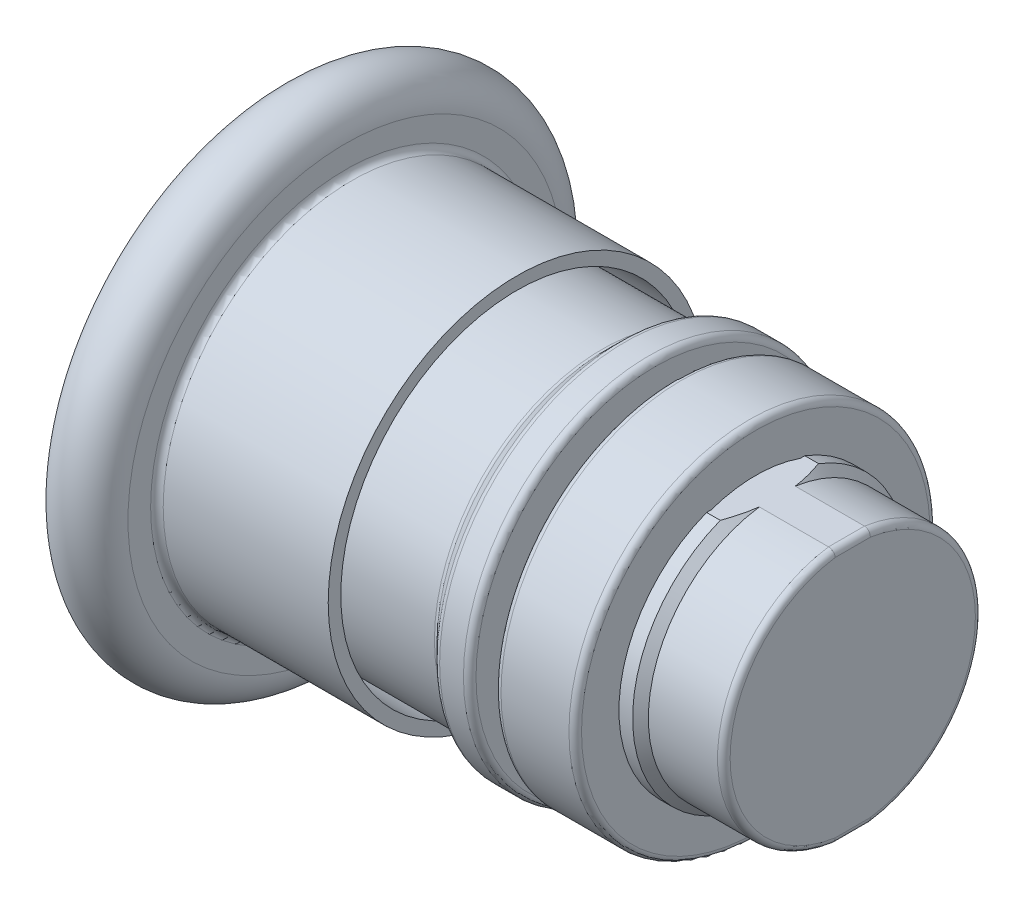
from build123d import *

# Parameters (mm, degrees)
CUT_EXTRUDE1_REACH = 56.598
SKETCH3_W          = 6.4
SKETCH3_H          = 3.6
FILLET1_R          = 0.5
FILLET2_R          = 0.5


with BuildPart() as part:
    # Sketch1 → Revolve-Thin1 (revolve)
    with BuildSketch(Plane.XY, mode=Mode.PRIVATE) as revolve_thin1_sk:
        with BuildLine():
            ThreePointArc((-20, 0), (-19.749798687, 8.817054455), (-19, 17.605731937))
            ThreePointArc((-19, 17.605731937), (-16.164253119, 19.995655135), (-13.617365477, 17.3))
            Line((-13.617365477, 17.3), (-13.617365477, 15))
            Line((-13.617365477, 15), (0, 15))
            Line((0, 15), (0, 14))
            Line((0, 14), (-14.617365477, 14))
            Line((-14.617365477, 14), (-14.617365477, 17.3))
            ThreePointArc((-14.617365477, 17.3), (-16.2209614, 18.997264344), (-18.006431658, 17.492497886))
            ThreePointArc((-18.006431658, 17.492497886), (-18.751407896, 8.760346174), (-19, 0))
            Line((-19, 0), (-20, 0))
        make_face()
    revolve(revolve_thin1_sk.sketch.rotate(Axis((0, 0, 0), (-1, 0, 0)), 90), axis=Axis((0, 0, 0), (-1, 0, 0)))

    # Fillet2
    fillet2_edges = [part.edges().sort_by_distance(p)[0] for p in [
        (-13.617365477, 0, 15),
    ]]
    fillet(fillet2_edges, radius=FILLET2_R)


with BuildPart() as body_2:
    # Sketch2 → Revolve1 (revolve)
    with BuildSketch(Plane.XY, mode=Mode.PRIVATE) as revolve1_sk:
        Polygon((26.7, 0), (26.7, 10.25), (20.7, 10.25), (20.075, 10.875), (11, 10.875), (11, 14.75), (8.4, 14.75), (7, 13.35), (-13.617365477, 13.35), (-13.617365477, 0), align=None)
    revolve(revolve1_sk.sketch.rotate(Axis((0, 0, 0), (1, 0, 0)), 90), axis=Axis((0, 0, 0), (1, 0, 0)))

    # Cut-Extrude1: up to this face of the body (flat: up to its plane)
    cut_extrude1_end = Plane(body_2.part.faces().sort_by_distance((11, 0, -11.292193001))[0])
    # Sketch4 → Cut-Extrude1 (cut, up to the picked face)
    with BuildSketch(Plane(origin=(26.7, 0, 0), x_dir=(0, 0, -1), z_dir=(1, 0, 0)), mode=Mode.PRIVATE) as cut_extrude1_sk1:
        with BuildLine():
            Line((-3.904244485, 10.15), (3.904244485, 10.15))
            ThreePointArc((3.904244485, 10.15), (0, 10.875), (-3.904244485, 10.15))
        make_face()
    cut_extrude1_tool1 = split(extrude(cut_extrude1_sk1.sketch, amount=-CUT_EXTRUDE1_REACH, mode=Mode.PRIVATE), bisect_by=cut_extrude1_end, keep=Keep.BOTH, mode=Mode.PRIVATE)
    # Sketch4 → Cut-Extrude1 (cut, up to the picked face)
    with BuildSketch(Plane(origin=(26.7, 0, 0), x_dir=(0, 0, -1), z_dir=(1, 0, 0)), mode=Mode.PRIVATE) as cut_extrude1_sk2:
        with BuildLine():
            Line((-3.904244485, -10.15), (3.904244485, -10.15))
            ThreePointArc((3.904244485, -10.15), (0, -10.875), (-3.904244485, -10.15))
        make_face()
    cut_extrude1_tool2 = split(extrude(cut_extrude1_sk2.sketch, amount=-CUT_EXTRUDE1_REACH, mode=Mode.PRIVATE), bisect_by=cut_extrude1_end, keep=Keep.BOTH, mode=Mode.PRIVATE)
    add(cut_extrude1_tool1.solids().sort_by(Axis((26.7, 10.440845, 0), (-1, 0, 0)))[0], mode=Mode.SUBTRACT)
    add(cut_extrude1_tool2.solids().sort_by(Axis((26.7, -10.440845, 0), (-1, 0, 0)))[0], mode=Mode.SUBTRACT)

    # Sketch3 → Revolve2 (revolve)
    with BuildSketch(Plane.XY):
        with Locations((15.7875, 12.55)):
            Rectangle(SKETCH3_W, SKETCH3_H)
    revolve(axis=Axis((0, 0, 0), (1, 0, 0)))

    # Fillet1
    # the kernel refuses this fillet: 0.5 mm, written as the material it adds along each edge
    with BuildSketch(Plane(origin=(7, 0, 0), x_dir=(0, 0, 1), z_dir=(0, 1, 0))) as fillet1_piece_1:
        with BuildLine():
            CenterArc((13.35 + FILLET1_R, -FILLET1_R * 0.414213562373), FILLET1_R, 135, 45)
            Line((13.35, -FILLET1_R * 0.414213562373), (13.35 - FILLET1_R * 0.02, -FILLET1_R * 0.414213562373))
            Line((13.35 - FILLET1_R * 0.02, -FILLET1_R * 0.414213562373), (13.35 - FILLET1_R * 0.02, FILLET1_R * 0.00828427124746))
            Line((13.35 - FILLET1_R * 0.02, FILLET1_R * 0.00828427124746), (13.35 + FILLET1_R * 0.27875108319, FILLET1_R * 0.307035354437))
            Line((13.35 + FILLET1_R * 0.27875108319, FILLET1_R * 0.307035354437), (13.35 + FILLET1_R * 0.292893218813, FILLET1_R * 0.292893218813))
        make_face()
    revolve(axis=Axis((7, 0, 0), (1, 0, 0)))
    # the kernel refuses this fillet: 0.5 mm, written as the material it takes off along each edge
    with BuildSketch(Plane(origin=(26.7, 0, 0), x_dir=(0, -0.9998436081604841, -0.017684999876288746), z_dir=(0, -0.017684999876288746, 0.9998436081604841))) as fillet1_2_piece_1:
        with BuildLine():
            CenterArc((10.25 - FILLET1_R, -FILLET1_R), FILLET1_R, 0, 90)
            Line((10.25, -FILLET1_R), (10.25 + FILLET1_R * 0.02, -FILLET1_R))
            Line((10.25 + FILLET1_R * 0.02, -FILLET1_R), (10.25 + FILLET1_R * 0.02, FILLET1_R * 0.02))
            Line((10.25 + FILLET1_R * 0.02, FILLET1_R * 0.02), (10.25 - FILLET1_R, FILLET1_R * 0.02))
            Line((10.25 - FILLET1_R, FILLET1_R * 0.02), (10.25 - FILLET1_R, 0))
        make_face()
    revolve(axis=Axis((26.7, 0, 0), (1, 0, 0)), revolution_arc=177.973342641, mode=Mode.SUBTRACT)
    with BuildSketch(Plane(origin=(26.7, 0, 0), x_dir=(0, 0.999843608160485, 0.0176849998762355), z_dir=(0, 0.0176849998762355, -0.999843608160485))) as fillet1_2_piece_2:
        with BuildLine():
            CenterArc((10.25 - FILLET1_R, -FILLET1_R), FILLET1_R, 0, 90)
            Line((10.25, -FILLET1_R), (10.25 + FILLET1_R * 0.02, -FILLET1_R))
            Line((10.25 + FILLET1_R * 0.02, -FILLET1_R), (10.25 + FILLET1_R * 0.02, FILLET1_R * 0.02))
            Line((10.25 + FILLET1_R * 0.02, FILLET1_R * 0.02), (10.25 - FILLET1_R, FILLET1_R * 0.02))
            Line((10.25 - FILLET1_R, FILLET1_R * 0.02), (10.25 - FILLET1_R, 0))
        make_face()
    revolve(axis=Axis((26.7, 0, 0), (1, 0, 0)), revolution_arc=177.973342641, mode=Mode.SUBTRACT)
    with BuildSketch(Plane(origin=(26.7, 10.15, 2.678285686), x_dir=(0, -1, 0), z_dir=(0, 0, -1))) as fillet1_2_piece_3:
        with BuildLine():
            CenterArc((FILLET1_R, FILLET1_R), FILLET1_R, 180, 90)
            Line((0, FILLET1_R), (-FILLET1_R * 0.02, FILLET1_R))
            Line((-FILLET1_R * 0.02, FILLET1_R), (-FILLET1_R * 0.02, -FILLET1_R * 0.02))
            Line((-FILLET1_R * 0.02, -FILLET1_R * 0.02), (FILLET1_R, -FILLET1_R * 0.02))
            Line((FILLET1_R, -FILLET1_R * 0.02), (FILLET1_R, 0))
        make_face()
    extrude(amount=5.356571371, mode=Mode.SUBTRACT)
    with BuildSketch(Plane(origin=(26.7, -10.15, 2.678285686), x_dir=(0, 1, 0), z_dir=(0, 0, -1))) as fillet1_2_piece_4:
        with BuildLine():
            CenterArc((FILLET1_R, -FILLET1_R), FILLET1_R, 90, 90)
            Line((0, -FILLET1_R), (-FILLET1_R * 0.02, -FILLET1_R))
            Line((-FILLET1_R * 0.02, -FILLET1_R), (-FILLET1_R * 0.02, FILLET1_R * 0.02))
            Line((-FILLET1_R * 0.02, FILLET1_R * 0.02), (FILLET1_R, FILLET1_R * 0.02))
            Line((FILLET1_R, FILLET1_R * 0.02), (FILLET1_R, 0))
        make_face()
    extrude(amount=5.356571371, mode=Mode.SUBTRACT)
    with BuildSketch(Plane(origin=(12.5875, 0, 0), x_dir=(0, 1, 0), z_dir=(0, 0, -1))) as fillet1_2_piece_5:
        with BuildLine():
            CenterArc((14.35 - FILLET1_R, FILLET1_R), FILLET1_R, 270, 90)
            Line((14.35, FILLET1_R), (14.35 + FILLET1_R * 0.02, FILLET1_R))
            Line((14.35 + FILLET1_R * 0.02, FILLET1_R), (14.35 + FILLET1_R * 0.02, -FILLET1_R * 0.02))
            Line((14.35 + FILLET1_R * 0.02, -FILLET1_R * 0.02), (14.35 - FILLET1_R, -FILLET1_R * 0.02))
            Line((14.35 - FILLET1_R, -FILLET1_R * 0.02), (14.35 - FILLET1_R, 0))
        make_face()
    revolve(axis=Axis((12.5875, 0, 0), (1, 0, 0)), mode=Mode.SUBTRACT)
    with BuildSketch(Plane(origin=(18.9875, 0, 0), x_dir=(0, 1, 0), z_dir=(0, 0, -1))) as fillet1_2_piece_6:
        with BuildLine():
            CenterArc((14.35 - FILLET1_R, -FILLET1_R), FILLET1_R, 0, 90)
            Line((14.35, -FILLET1_R), (14.35 + FILLET1_R * 0.02, -FILLET1_R))
            Line((14.35 + FILLET1_R * 0.02, -FILLET1_R), (14.35 + FILLET1_R * 0.02, FILLET1_R * 0.02))
            Line((14.35 + FILLET1_R * 0.02, FILLET1_R * 0.02), (14.35 - FILLET1_R, FILLET1_R * 0.02))
            Line((14.35 - FILLET1_R, FILLET1_R * 0.02), (14.35 - FILLET1_R, 0))
        make_face()
    revolve(axis=Axis((18.9875, 0, 0), (1, 0, 0)), mode=Mode.SUBTRACT)
    with BuildSketch(Plane(origin=(8.4, 0, 0), x_dir=(0, 0, 1), z_dir=(0, 1, 0))) as fillet1_2_piece_7:
        with BuildLine():
            CenterArc((14.75 - FILLET1_R, FILLET1_R * 0.414213562373), FILLET1_R, 315, 45)
            Line((14.75 - FILLET1_R * 0.292893218813, -FILLET1_R * 0.292893218813), (14.75 - FILLET1_R * 0.27875108319, -FILLET1_R * 0.307035354437))
            Line((14.75 - FILLET1_R * 0.27875108319, -FILLET1_R * 0.307035354437), (14.75 + FILLET1_R * 0.02, -FILLET1_R * 0.00828427124746))
            Line((14.75 + FILLET1_R * 0.02, -FILLET1_R * 0.00828427124746), (14.75 + FILLET1_R * 0.02, FILLET1_R * 0.414213562373))
            Line((14.75 + FILLET1_R * 0.02, FILLET1_R * 0.414213562373), (14.75, FILLET1_R * 0.414213562373))
        make_face()
    revolve(axis=Axis((8.4, 0, 0), (1, 0, 0)), mode=Mode.SUBTRACT)
    with BuildSketch(Plane(origin=(11, 0, 0), x_dir=(0, 0, 1), z_dir=(0, 1, 0))) as fillet1_2_piece_8:
        with BuildLine():
            CenterArc((14.75 - FILLET1_R, -FILLET1_R), FILLET1_R, 0, 90)
            Line((14.75, -FILLET1_R), (14.75 + FILLET1_R * 0.02, -FILLET1_R))
            Line((14.75 + FILLET1_R * 0.02, -FILLET1_R), (14.75 + FILLET1_R * 0.02, FILLET1_R * 0.02))
            Line((14.75 + FILLET1_R * 0.02, FILLET1_R * 0.02), (14.75 - FILLET1_R, FILLET1_R * 0.02))
            Line((14.75 - FILLET1_R, FILLET1_R * 0.02), (14.75 - FILLET1_R, 0))
        make_face()
    revolve(axis=Axis((11, 0, 0), (1, 0, 0)), mode=Mode.SUBTRACT)


solid = Compound([part.part, body_2.part])
